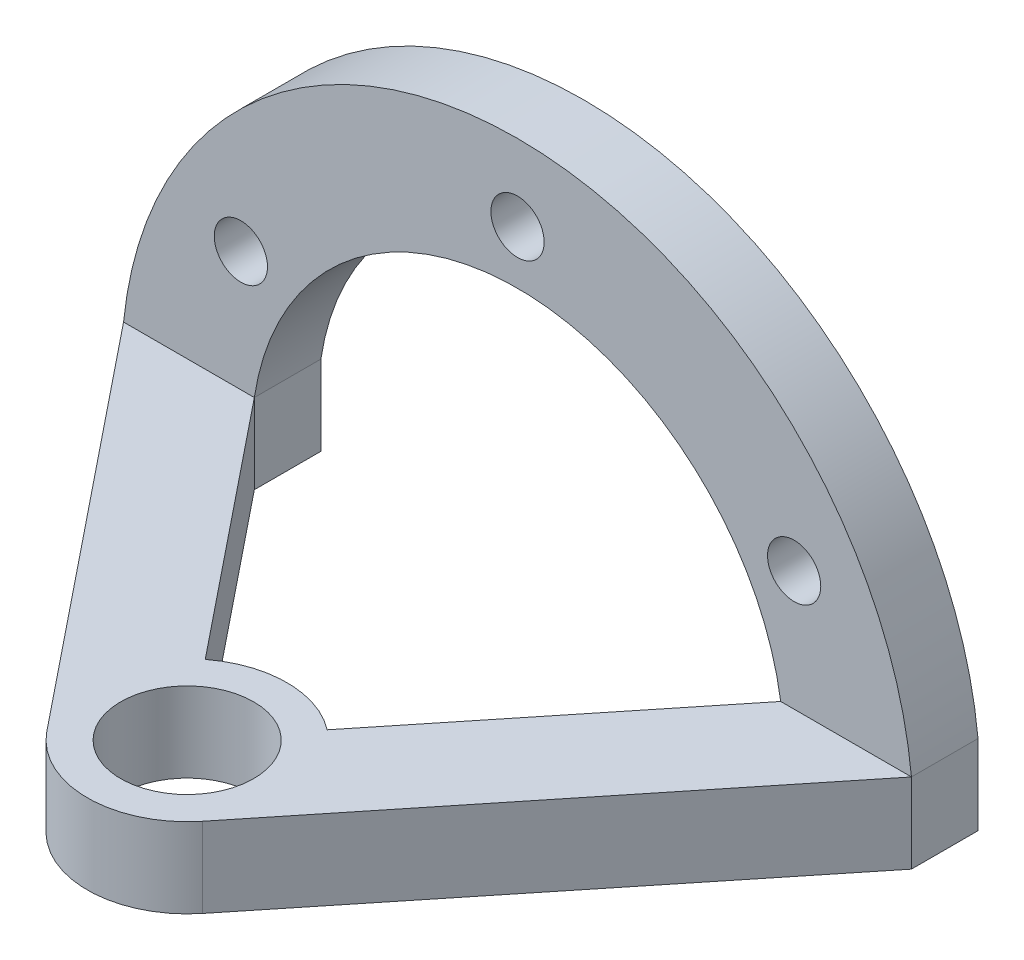
from build123d import *

# Parameters (mm, degrees)
SKETCH1_R           = 2
BOSS_EXTRUDE1_DEPTH = 5
SKETCH2_R           = 5
BOSS_EXTRUDE2_DEPTH = 6


with BuildPart() as part:
    # Sketch1 → Boss-Extrude1 (new body)
    with BuildSketch(Plane.XY):
        with BuildLine():
            Line((-29.598352995, 3), (-19.773719933, 3))
            ThreePointArc((-19.773719933, 3), (0, 20), (19.773719933, 3))
            Line((19.773719933, 3), (29.598352995, 3))
            ThreePointArc((29.598352995, 3), (0, 29.75), (-29.598352995, 3))
        make_face()
        with Locations((0, 24)):
            Circle(SKETCH1_R, mode=Mode.SUBTRACT)
        with Locations((20.784609691, 12)):
            Circle(SKETCH1_R, mode=Mode.SUBTRACT)
        with Locations((-20.784609691, 12)):
            Circle(SKETCH1_R, mode=Mode.SUBTRACT)
    extrude(amount=BOSS_EXTRUDE1_DEPTH)

    # Sketch2 → Boss-Extrude2 (add)
    with BuildSketch(Plane.XZ.offset(-3)):
        with BuildLine():
            Line((19.773719933, 0), (29.598352995, 0))
            Line((29.598352995, 0), (29.598352995, 5))
            Line((29.598352995, 5), (5.843197001, 34.521813354))
            ThreePointArc((5.843197001, 34.521813354), (0, 37.32), (-5.843197001, 34.521813354))
            Line((-5.843197001, 34.521813354), (-29.598352995, 5))
            Line((-29.598352995, 5), (-29.598352995, 0))
            Line((-29.598352995, 0), (-19.773719933, 0))
            Line((-19.773719933, 0), (-19.773719933, 5))
            Line((-19.773719933, 5), (-4.580602424, 23.88130642))
            ThreePointArc((-4.580602424, 23.88130642), (0, 22.32), (4.580602424, 23.88130642))
            Line((4.580602424, 23.88130642), (19.773719933, 5))
            Line((19.773719933, 5), (19.773719933, 0))
        make_face()
        with Locations((0, 29.82)):
            Circle(SKETCH2_R, mode=Mode.SUBTRACT)
    extrude(amount=BOSS_EXTRUDE2_DEPTH)


solid = part.part
